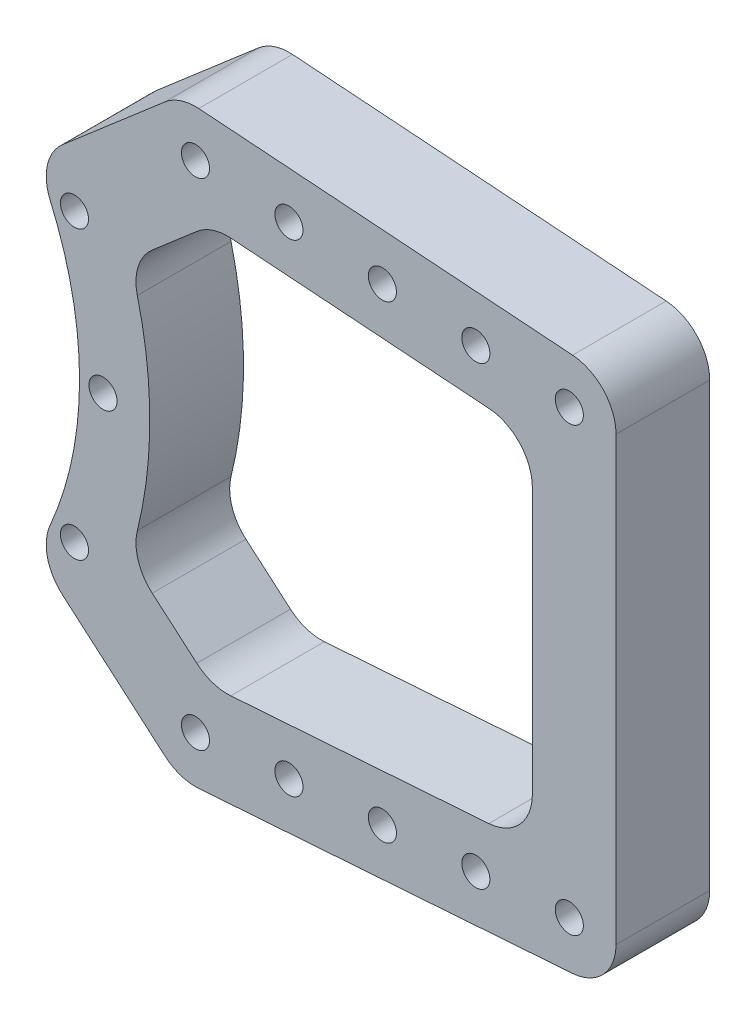
from build123d import *

# Parameters (mm, degrees)
EXTRUDE_1_DEPTH     = 15
FILLET_1_R          = 5
FILLET_2_R          = 5
FILLET_3_R          = 5
FILLET_4_R          = 5
FILLET_5_R          = 5
FILLET_6_R          = 5
FILLET_7_R          = 5
FILLET_8_R          = 5
FILLET_9_R          = 5
FILLET_10_R         = 5
FILLET_11_R         = 5
FILLET_12_R         = 5
FILLET_13_R         = 5
FILLET_14_R         = 5
FILLET_15_R         = 5
FILLET_16_R         = 5
SKETCH_5_R          = 1.5
CUT_EXTRUDE_1_DEPTH = 15
SKETCH_6_R          = 1.5
CUT_EXTRUDE_5_DEPTH = 15
EXTRUDE_2_DEPTH     = 15
FILLET_17_R         = 5
FILLET_18_R         = 5
FILLET_19_R         = 5
FILLET_20_R         = 5
SKETCH_8_W          = 96.520141499
SKETCH_8_H          = 72.316132992
CUT_EXTRUDE_6_DEPTH = 5


with BuildPart() as part:
    # 草图3 → 凸台-拉伸1 (new body)
    with BuildSketch(Plane.XY):
        with BuildLine():
            Line((32.743622368, -18.278544642), (48.171786379, -31.57189699))
            Line((48.171786379, -31.57189699), (101.99145665, -27.727634828))
            Line((101.99145665, -27.727634828), (114.18506552, -15.283623844))
            ThreePointArc((114.18506552, -15.283623844), (110, 0), (114.18506552, 15.283623844))
            Line((114.18506552, 15.283623844), (101.99145665, 27.727634828))
            Line((101.99145665, 27.727634828), (48.171786379, 31.57189699))
            Line((48.171786379, 31.57189699), (32.743622368, 18.278544642))
            ThreePointArc((32.743622368, 18.278544642), (37.5, 0), (32.743622368, -18.278544642))
        make_face()
        with BuildLine():
            Line((42.839131819, 13.777110909), (51.574083604, 21.303398011))
            Line((51.574083604, 21.303398011), (97.500283316, 18.022955175))
            Line((97.500283316, 18.022955175), (106.212331228, 9.132000819))
            ThreePointArc((106.212331228, 9.132000819), (105, 0), (106.212331228, -9.132000819))
            Line((106.212331228, -9.132000819), (97.500283316, -18.022955175))
            Line((97.500283316, -18.022955175), (51.574083604, -21.303398011))
            Line((51.574083604, -21.303398011), (42.839131819, -13.777110909))
            ThreePointArc((42.839131819, -13.777110909), (45, 0), (42.839131819, 13.777110909))
        make_face(mode=Mode.SUBTRACT)
    extrude(amount=EXTRUDE_1_DEPTH)

    # 圆角1
    fillet_1_edges = [part.edges().sort_by_distance(p)[0] for p in [
        (101.99145665, 27.727634828, 7.5),
    ]]
    fillet(fillet_1_edges, radius=FILLET_1_R)

    # 圆角2
    fillet_2_edges = [part.edges().sort_by_distance(p)[0] for p in [
        (114.18506552, 15.283623844, 7.5),
    ]]
    fillet(fillet_2_edges, radius=FILLET_2_R)

    # 圆角3
    fillet_3_edges = [part.edges().sort_by_distance(p)[0] for p in [
        (114.18506552, -15.283623844, 7.5),
    ]]
    fillet(fillet_3_edges, radius=FILLET_3_R)

    # 圆角4
    fillet_4_edges = [part.edges().sort_by_distance(p)[0] for p in [
        (101.99145665, -27.727634828, 7.5),
    ]]
    fillet(fillet_4_edges, radius=FILLET_4_R)

    # 圆角5
    fillet_5_edges = [part.edges().sort_by_distance(p)[0] for p in [
        (48.171786379, -31.57189699, 7.5),
    ]]
    fillet(fillet_5_edges, radius=FILLET_5_R)

    # 圆角6
    fillet_6_edges = [part.edges().sort_by_distance(p)[0] for p in [
        (48.171786379, 31.57189699, 7.5),
    ]]
    fillet(fillet_6_edges, radius=FILLET_6_R)

    # 圆角7
    fillet_7_edges = [part.edges().sort_by_distance(p)[0] for p in [
        (32.743622368, -18.278544642, 7.5),
    ]]
    fillet(fillet_7_edges, radius=FILLET_7_R)

    # 圆角8
    fillet_8_edges = [part.edges().sort_by_distance(p)[0] for p in [
        (32.743622368, 18.278544642, 7.5),
    ]]
    fillet(fillet_8_edges, radius=FILLET_8_R)

    # 圆角9
    fillet_9_edges = [part.edges().sort_by_distance(p)[0] for p in [
        (97.500283316, -18.022955175, 7.5),
    ]]
    fillet(fillet_9_edges, radius=FILLET_9_R)

    # 圆角10
    fillet_10_edges = [part.edges().sort_by_distance(p)[0] for p in [
        (106.212331228, -9.132000819, 7.5),
    ]]
    fillet(fillet_10_edges, radius=FILLET_10_R)

    # 圆角11
    fillet_11_edges = [part.edges().sort_by_distance(p)[0] for p in [
        (106.212331228, 9.132000819, 7.5),
    ]]
    fillet(fillet_11_edges, radius=FILLET_11_R)

    # 圆角12
    fillet_12_edges = [part.edges().sort_by_distance(p)[0] for p in [
        (97.500283316, 18.022955175, 7.5),
    ]]
    fillet(fillet_12_edges, radius=FILLET_12_R)

    # 圆角13
    fillet_13_edges = [part.edges().sort_by_distance(p)[0] for p in [
        (51.574083604, -21.303398011, 7.5),
    ]]
    fillet(fillet_13_edges, radius=FILLET_13_R)

    # 圆角14
    fillet_14_edges = [part.edges().sort_by_distance(p)[0] for p in [
        (42.839131819, -13.777110909, 7.5),
    ]]
    fillet(fillet_14_edges, radius=FILLET_14_R)

    # 圆角15
    fillet_15_edges = [part.edges().sort_by_distance(p)[0] for p in [
        (42.839131819, 13.777110909, 7.5),
    ]]
    fillet(fillet_15_edges, radius=FILLET_15_R)

    # 圆角16
    fillet_16_edges = [part.edges().sort_by_distance(p)[0] for p in [
        (51.574083604, 21.303398011, 7.5),
    ]]
    fillet(fillet_16_edges, radius=FILLET_16_R)

    # 草图5 → 切除-拉伸1 (cut)
    with BuildSketch(Plane(origin=(0, 0, 0), x_dir=(-1, 0, 0), z_dir=(0, 0, -1))):
        with Locations((-36.9551813, 15.307337295)):
            Circle(SKETCH_5_R)
        with Locations((-40, 0)):
            Circle(SKETCH_5_R)
        with Locations((-36.9551813, -15.307337295)):
            Circle(SKETCH_5_R)
        with Locations((-49.872934992, -26.437647501)):
            Circle(SKETCH_5_R)
        with Locations((-49.872934992, 26.437647501)):
            Circle(SKETCH_5_R)
        with Locations((-99.745869983, 22.875295001)):
            Circle(SKETCH_5_R)
        with Locations((-99.745869983, -22.875295001)):
            Circle(SKETCH_5_R)
        with Locations((-109.973915193, 12.437211552)):
            Circle(SKETCH_5_R)
        with Locations((-107.5, 0)):
            Circle(SKETCH_5_R)
        with Locations((-109.973915193, -12.437211552)):
            Circle(SKETCH_5_R)
        with Locations((-59.84752199, 25.725177001)):
            Circle(SKETCH_5_R)
        with Locations((-69.822108988, 25.012706501)):
            Circle(SKETCH_5_R)
        with Locations((-79.796695986, 24.300236001)):
            Circle(SKETCH_5_R)
        with Locations((-89.771282985, 23.587765501)):
            Circle(SKETCH_5_R)
        with Locations((-89.771282985, -23.587765501)):
            Circle(SKETCH_5_R)
        with Locations((-79.796695986, -24.300236001)):
            Circle(SKETCH_5_R)
        with Locations((-69.822108988, -25.012706501)):
            Circle(SKETCH_5_R)
        with Locations((-59.84752199, -25.725177001)):
            Circle(SKETCH_5_R)
    extrude(amount=-CUT_EXTRUDE_1_DEPTH, mode=Mode.SUBTRACT)

    # 草图6 → 切除-拉伸5 (cut)
    with BuildSketch(Plane.XY.offset(15)):
        with BuildLine():
            ThreePointArc((103.31715251, 26.374715112), (101.845820167, 27.412938577), (100.102105233, 27.8625885))
            Line((100.102105233, 27.8625885), (94.758576484, 28.244269125))
            Line((94.758576484, 28.244269125), (94.758576484, 18.218791377))
            Line((94.758576484, 18.218791377), (95.610931899, 18.157908847))
            ThreePointArc((95.610931899, 18.157908847), (97.354646834, 17.708258924), (98.825979176, 16.670035459))
            Line((98.825979176, 16.670035459), (104.297377986, 11.086278624))
            ThreePointArc((104.297377986, 11.086278624), (105.514152308, 9.027175008), (105.635333526, 6.638501199))
            ThreePointArc((105.635333526, 6.638501199), (105, 0), (105.635333526, -6.638501199))
            ThreePointArc((105.635333526, -6.638501199), (105.514152308, -9.027175008), (104.297377986, -11.086278624))
            Line((104.297377986, -11.086278624), (98.825979176, -16.670035459))
            ThreePointArc((98.825979176, -16.670035459), (97.354646834, -17.708258924), (95.610931899, -18.157908847))
            Line((95.610931899, -18.157908847), (94.758576484, -18.218791377))
            Line((94.758576484, -18.218791377), (94.758576484, -28.244269125))
            Line((94.758576484, -28.244269125), (100.102105233, -27.8625885))
            ThreePointArc((100.102105233, -27.8625885), (101.845820167, -27.412938577), (103.31715251, -26.374715112))
            Line((103.31715251, -26.374715112), (111.655402821, -17.865234485))
            ThreePointArc((111.655402821, -17.865234485), (113.00675492, -15.241981218), (112.643531681, -12.313555178))
            ThreePointArc((112.643531681, -12.313555178), (110, 0), (112.643531681, 12.313555178))
            ThreePointArc((112.643531681, 12.313555178), (113.00675492, 15.241981218), (111.655402821, 17.865234485))
            Line((111.655402821, 17.865234485), (103.31715251, 26.374715112))
        make_face()
        with Locations((99.745869983, -22.875295001)):
            Circle(SKETCH_6_R, mode=Mode.SUBTRACT)
        with Locations((99.745869983, 22.875295001)):
            Circle(SKETCH_6_R, mode=Mode.SUBTRACT)
        with Locations((109.973915193, -12.437211552)):
            Circle(SKETCH_6_R, mode=Mode.SUBTRACT)
        with Locations((107.5, 0)):
            Circle(SKETCH_6_R, mode=Mode.SUBTRACT)
        with Locations((109.973915193, 12.437211552)):
            Circle(SKETCH_6_R, mode=Mode.SUBTRACT)
    extrude(amount=-CUT_EXTRUDE_5_DEPTH, mode=Mode.SUBTRACT)

    # 草图7 → 凸台-拉伸2 (add)
    with BuildSketch(Plane.XY.offset(15)):
        Polygon((94.758576484, -18.218791377), (94.758576484, 18.218791377), (85.826771952, 18.856777415), (85.826771952, -18.856777415), align=None)
    extrude(amount=-EXTRUDE_2_DEPTH)

    # 圆角17
    fillet_17_edges = [part.edges().sort_by_distance(p)[0] for p in [
        (94.758576484, 28.244269125, 7.5),
    ]]
    fillet(fillet_17_edges, radius=FILLET_17_R)

    # 圆角18
    fillet_18_edges = [part.edges().sort_by_distance(p)[0] for p in [
        (94.758576484, -28.244269125, 7.5),
    ]]
    fillet(fillet_18_edges, radius=FILLET_18_R)

    # 圆角19
    fillet_19_edges = [part.edges().sort_by_distance(p)[0] for p in [
        (85.826771952, 18.856777415, 7.5),
    ]]
    fillet(fillet_19_edges, radius=FILLET_19_R)

    # 圆角20
    fillet_20_edges = [part.edges().sort_by_distance(p)[0] for p in [
        (85.826771952, -18.856777415, 7.5),
    ]]
    fillet(fillet_20_edges, radius=FILLET_20_R)

    # 草图8 → 切除-拉伸6 (cut)
    with BuildSketch(Plane(origin=(0, 0, 0), x_dir=(-1, 0, 0), z_dir=(0, 0, -1))):
        with Locations((-67.250576804, -3.787424314)):
            Rectangle(SKETCH_8_W, SKETCH_8_H)
    extrude(amount=-CUT_EXTRUDE_6_DEPTH, mode=Mode.SUBTRACT)


solid = part.part
